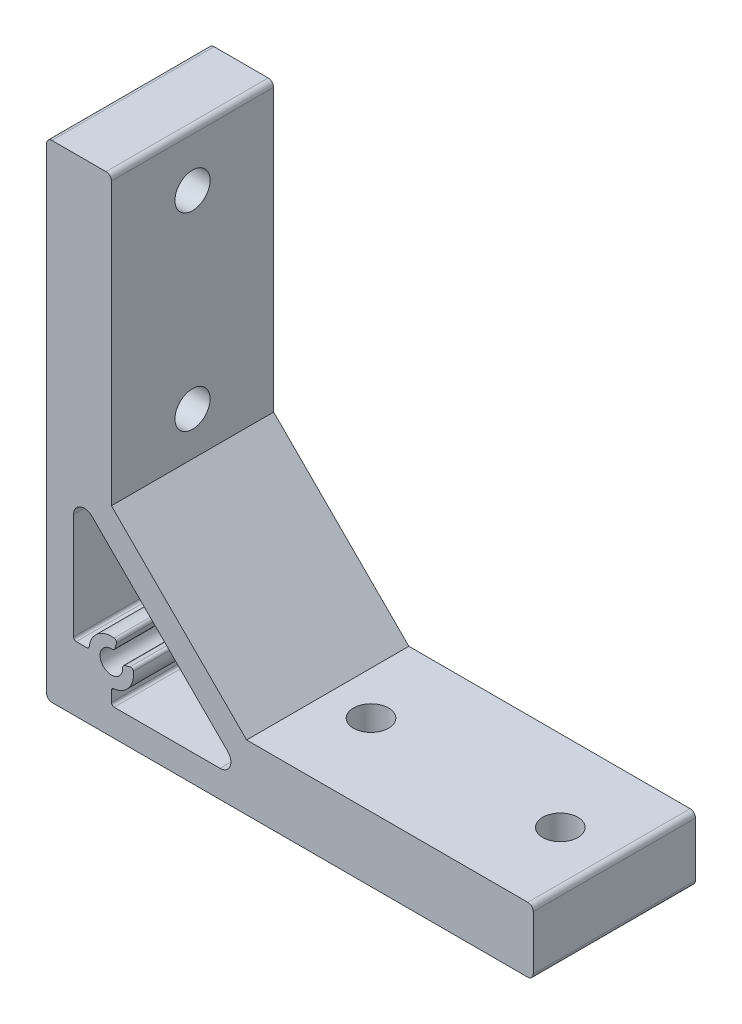
from build123d import *

# Parameters (mm, degrees)
EXTRUDE_22_DEPTH     = 30
SKETCH_72_R          = 3.25
CUT_EXTRUDE_49_DEPTH = 123.816936943
SKETCH_73_R          = 3.25
CUT_EXTRUDE_50_DEPTH = 131.766968306


with BuildPart() as part:
    # 草图71 → 凸台-拉伸22 (new body)
    with BuildSketch(Plane.XY):
        with BuildLine():
            Line((1, 0), (89, 0))
            ThreePointArc((89, 0), (89.707106781, 0.292893219), (90, 1))
            Line((90, 1), (90, 11))
            ThreePointArc((90, 11), (89.707106781, 11.707106781), (89, 12))
            Line((89, 12), (37, 12))
            Line((37, 12), (12, 37))
            Line((12, 37), (12, 89))
            ThreePointArc((12, 89), (11.707106781, 89.707106781), (11, 90))
            Line((11, 90), (1, 90))
            ThreePointArc((1, 90), (0.292893219, 89.707106781), (0, 89))
            Line((0, 89), (0, 1))
            ThreePointArc((0, 1), (0.292893219, 0.292893219), (1, 0))
        make_face()
        with BuildLine():
            Line((12, 7.427254654), (12, 5.5))
            ThreePointArc((12, 5.5), (12.146446609, 5.146446609), (12.5, 5))
            Line((12.5, 5), (32.100505063, 5))
            ThreePointArc((32.100505063, 5), (33.948264128, 6.234633135), (33.514718626, 8.414213562))
            Line((33.514718626, 8.414213562), (8.414213562, 33.514718626))
            ThreePointArc((8.414213562, 33.514718626), (6.234633135, 33.948264128), (5, 32.100505063))
            Line((5, 32.100505063), (5, 12.5))
            ThreePointArc((5, 12.5), (5.146446609, 12.146446609), (5.5, 12))
            Line((5.5, 12), (7.427254654, 12))
            ThreePointArc((7.427254654, 12), (7.761040579, 12.127727309), (7.924292192, 12.445652174))
            ThreePointArc((7.924292192, 12.445652174), (9.454880771, 15.214400117), (12.500832214, 16.069295651))
            ThreePointArc((12.500832214, 16.069295651), (12.854314019, 15.852577049), (12.922718028, 15.443630561))
            Line((12.922718028, 15.443630561), (12.660369072, 14.464530927))
            ThreePointArc((12.660369072, 14.464530927), (12.468068335, 14.187104489), (12.14328959, 14.095105748))
            ThreePointArc((12.14328959, 14.095105748), (10.515075759, 10.51507576), (14.095105748, 12.14328959))
            ThreePointArc((14.095105748, 12.14328959), (14.187104488, 12.468068335), (14.464530927, 12.660369072))
            Line((14.464530927, 12.660369072), (15.443630561, 12.922718028))
            ThreePointArc((15.443630561, 12.922718028), (15.852577049, 12.854314019), (16.069295651, 12.500832214))
            ThreePointArc((16.069295651, 12.500832214), (15.214400117, 9.454880771), (12.445652174, 7.924292192))
            ThreePointArc((12.445652174, 7.924292192), (12.127727309, 7.761040579), (12, 7.427254654))
        make_face(mode=Mode.SUBTRACT)
    extrude(amount=-EXTRUDE_22_DEPTH)

    # 草图72 → 切除-拉伸49 (cut, through all)
    with BuildSketch(Plane(origin=(0, 12, 0), x_dir=(1, 0, 0), z_dir=(0, 1, 0))):
        with Locations((45, 15)):
            Circle(SKETCH_72_R)
        with Locations((80, 15)):
            Circle(SKETCH_72_R)
    extrude(amount=-CUT_EXTRUDE_49_DEPTH, mode=Mode.SUBTRACT)

    # 草图73 → 切除-拉伸50 (cut, through all)
    with BuildSketch(Plane.ZY):
        with Locations((-15, 80)):
            Circle(SKETCH_73_R)
        with Locations((-15, 45)):
            Circle(SKETCH_73_R)
    extrude(amount=-CUT_EXTRUDE_50_DEPTH, mode=Mode.SUBTRACT)


solid = part.part
